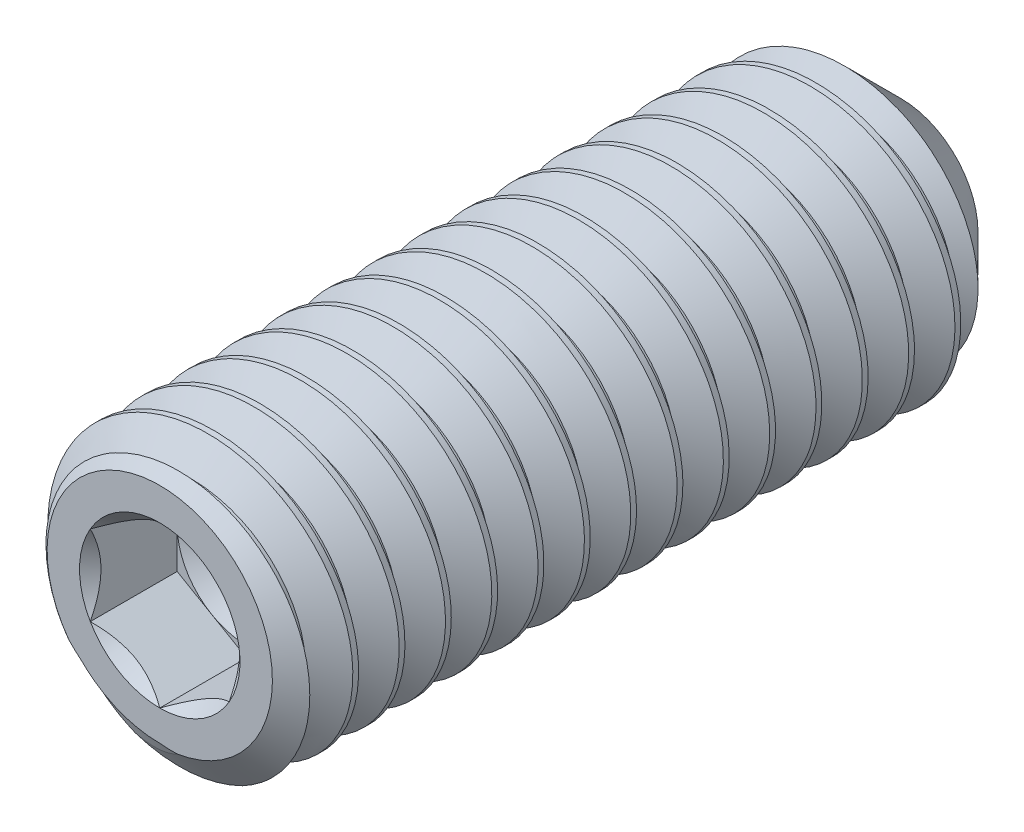
from build123d import *

# Parameters (mm, degrees)
CUT_SWEEP2_PITCH    = 0.79375
CUT_EXTRUDE10_DEPTH = 1.48828125


with BuildPart() as part:
    # Sketch22 → Revolve1 (revolve)
    with BuildSketch(Plane(origin=(0, 0, 0), x_dir=(0, 0, -1), z_dir=(1, 0, 0)), mode=Mode.PRIVATE) as revolve1_sk:
        Polygon((-5.952759232, 0), (-5.952759232, 1.9304), (-5.614839074, 2.413), (5.656480087, 2.413), (6.747240768, 1.322239319), (5.952759232, 0), align=None)
    revolve(revolve1_sk.sketch.rotate(Axis((0, 0, -5.952759232), (0, 0, -1)), 180), axis=Axis((0, 0, -5.952759232), (0, 0, -1)))

    # Cut-Sweep2: the profile of Sketch28 profile screwed along a right-hand helix of 17 turns, 8 arcs to a turn; built about Z, then put on its axis
    cut_sweep2_z = Axis((0, 0, 0), (0, 0, 1))
    cut_sweep2_corners = [(2.4133, 0, 0.000173205), (2.4133, 0, -0.694704455), (1.897444252, 0, -0.396875), (1.897444252, 0, -0.29765625)]
    with BuildLine(mode=Mode.PRIVATE) as cut_sweep2_profile:
        Line(cut_sweep2_corners[0], cut_sweep2_corners[1])
        Line(cut_sweep2_corners[1], cut_sweep2_corners[2])
        Line(cut_sweep2_corners[2], cut_sweep2_corners[3])
        Line(cut_sweep2_corners[3], cut_sweep2_corners[0])
    cut_sweep2_cap = Face(cut_sweep2_profile.wire())
    cut_sweep2_turn_angles = [0, 22.5, 45, 67.5, 90, 112.5, 135, 157.5, 180, 202.5, 225, 247.5, 270, 292.5, 315, 337.5, 360]
    cut_sweep2_turn_weights = [1, 0.9238795325112867, 1, 0.9238795325112867, 1, 0.9238795325112867, 1, 0.9238795325112867, 1, 0.9238795325112867, 1, 0.9238795325112867, 1, 0.9238795325112867, 1, 0.9238795325112867, 1]
    cut_sweep2_turn_rails = [Edge.make_bspline([Vector(p[0], p[1], 0).rotate(cut_sweep2_z, cut_sweep2_turn_angles[k]) / cut_sweep2_turn_weights[k] + Vector(0, 0, p[2] + CUT_SWEEP2_PITCH * cut_sweep2_turn_angles[k] / 360) for k in range(17)], [0, 0, 0, 1, 1, 2, 2, 3, 3, 4, 4, 5, 5, 6, 6, 7, 7, 8, 8, 8], 2, cut_sweep2_turn_weights) for p in cut_sweep2_corners]
    cut_sweep2_turn_sides = [Face.make_surface_from_curves(cut_sweep2_turn_rails[p[0]], cut_sweep2_turn_rails[p[1]]) for p in [(0, 1), (1, 2), (2, 3), (3, 0)]]
    cut_sweep2 = Plane(origin=(0, 0, -6.747240768), x_dir=(0, 1, 0), z_dir=(0, 0, 1)) * Solid(Shell([*[p.moved(Location((0, 0, CUT_SWEEP2_PITCH * i))) for i in range(17) for p in cut_sweep2_turn_sides], cut_sweep2_cap, cut_sweep2_cap.rotate(cut_sweep2_z, 6120).moved(Location((0, 0, CUT_SWEEP2_PITCH * 6120 / 360)))]))
    add(cut_sweep2, mode=Mode.SUBTRACT)

    # Sketch23 → Cut-Extrude10 (cut)
    with BuildSketch(Plane.XY.offset(5.952759232)):
        Polygon((0, 1.374815329), (-1.190625, 0.687407664), (-1.190625, -0.687407664), (0, -1.374815329), (1.190625, -0.687407664), (1.190625, 0.687407664), align=None)
    extrude(amount=-CUT_EXTRUDE10_DEPTH, mode=Mode.SUBTRACT)

    # Cut-Extrude11 cone 1 section (through the dimple's axis) → Cut-Extrude11 (revolve, cut)
    with BuildSketch(Plane(origin=(0, 0, 5.952759232), x_dir=(0, -1, 0), z_dir=(1, 0, 0))):
        Polygon((0, 0), (1.374815329, 0), (0, 1.374815329), align=None)
    revolve(axis=Axis((0, 0, 5.952759232), (0, 0, -1)), mode=Mode.SUBTRACT)

    # Cut-Extrude12 cone 1 section (through the dimple's axis) → Cut-Extrude12 (revolve, cut)
    with BuildSketch(Plane(origin=(0, 0, 4.464477982), x_dir=(0, -1, 0), z_dir=(1, 0, 0))):
        Polygon((0, 0), (1.190625, 0), (0, 0.687407664), align=None)
    revolve(axis=Axis((0, 0, 4.464477982), (0, 0, -1)), mode=Mode.SUBTRACT)


solid = part.part
